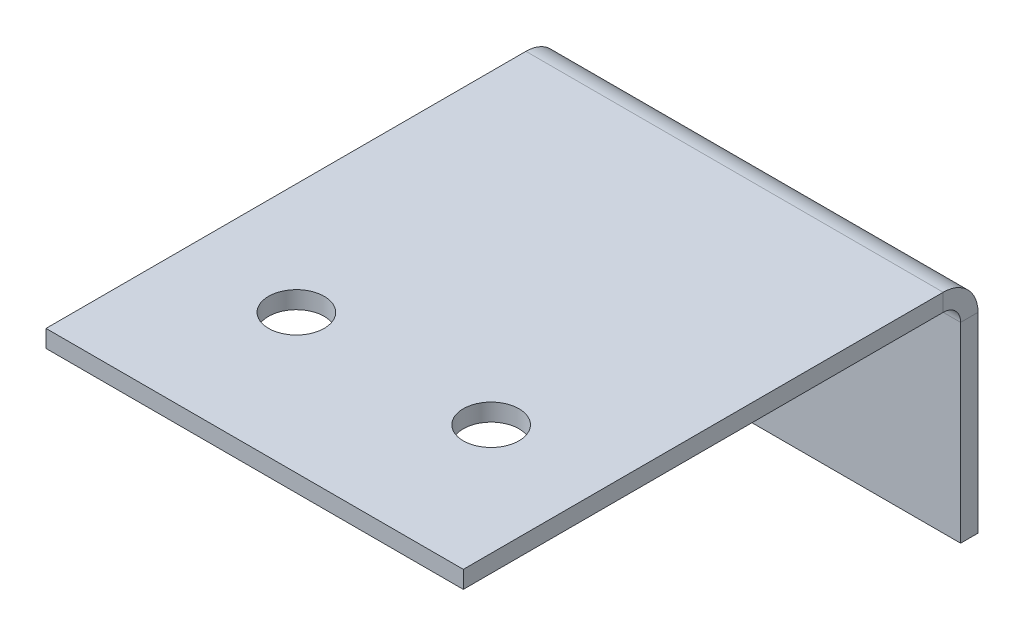
from build123d import *

# Parameters (mm, degrees)
SKETCH1_W                    = 38.1
SKETCH1_H                    = 46.99
BOSS_EXTRUDE1_DEPTH          = 1.5875
EDGE_FLANGE1_STRIP_W         = 9.525
EDGE_FLANGE1_STRIP_H         = 1.5875
EDGE_FLANGE1_STRIP_CUT_DEPTH = 38.1
EDGE_FLANGE1_DEPTH           = 38.1
SKETCH13_R                   = 2.54
CUT_EXTRUDE1_DEPTH           = 25.4


# Sheet-metal steps are written as plain solids
with BuildPart() as part:
    # Sketch1 → Boss-Extrude1 (new body)
    with BuildSketch(Plane(origin=(0, 0, 0), x_dir=(1, 0, 0), z_dir=(0, 1, 0))):
        Rectangle(SKETCH1_W, SKETCH1_H)
    extrude(amount=BOSS_EXTRUDE1_DEPTH)

    # Edge-Flange1 strip (across the edge) → Edge-Flange1 strip cut (cut)
    with BuildSketch(Plane(origin=(-19.05, 0, -23.495), x_dir=(0, 0, 1), z_dir=(1, 0, 0))):
        with Locations((-1.5875, -0.79375)):
            Rectangle(EDGE_FLANGE1_STRIP_W, EDGE_FLANGE1_STRIP_H)
    extrude(amount=EDGE_FLANGE1_STRIP_CUT_DEPTH, mode=Mode.SUBTRACT)

    # Edge-Flange1 section (across the edge) → Edge-Flange1 (add)
    with BuildSketch(Plane(origin=(-19.05, 0, -23.495), x_dir=(0, 0, 1), z_dir=(1, 0, 0))):
        with BuildLine():
            Line((0, 1.5875), (0, 19.05))
            Line((0, 19.05), (1.5875, 19.05))
            Line((1.5875, 19.05), (1.5875, 1.5875))
            ThreePointArc((1.5875, 1.5875), (2.052467985, 0.464967985), (3.175, 0))
            Line((3.175, 0), (3.175, -1.5875))
            ThreePointArc((3.175, -1.5875), (0.92993597, -0.65756403), (0, 1.5875))
        make_face()
    extrude(amount=EDGE_FLANGE1_DEPTH)

    # Sketch13 → Cut-Extrude1 (cut)
    with BuildSketch(Plane(origin=(0, 1.5875, 0), x_dir=(1, 0, 0), z_dir=(0, 1, 0))):
        with Locations(Location((8.89, -10.795, 0), (0, 0, 270))):
            Circle(SKETCH13_R)
        with Locations(Location((-8.89, -10.795, 0), (0, 0, 270))):
            Circle(SKETCH13_R)
    extrude(amount=-CUT_EXTRUDE1_DEPTH, mode=Mode.SUBTRACT)


solid = part.part
